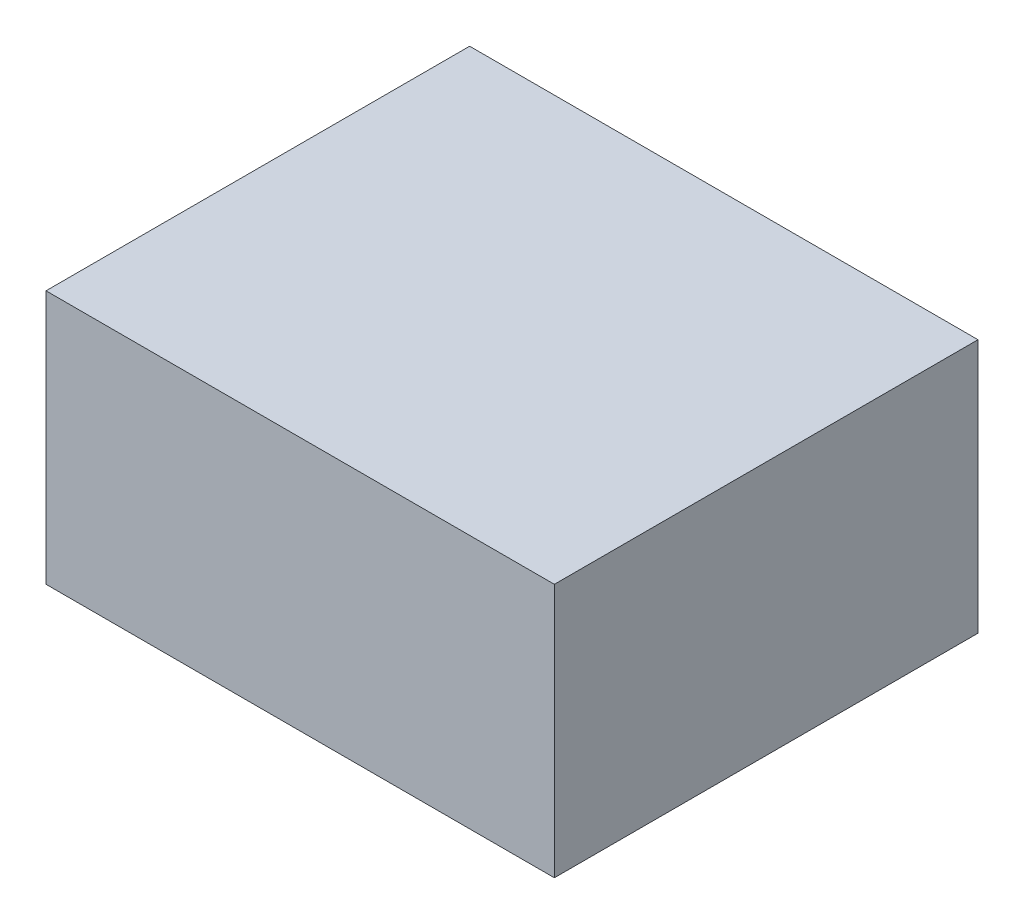
from build123d import *

# Parameters (mm, degrees)
SKETCH1_W           = 152.4
SKETCH1_H           = 127
BOSS_EXTRUDE1_DEPTH = 76.2


with BuildPart() as part:
    # Sketch1 → Boss-Extrude1 (new body)
    with BuildSketch(Plane(origin=(0, 0, 0), x_dir=(1, 0, 0), z_dir=(0, 1, 0))):
        Rectangle(SKETCH1_W, SKETCH1_H)
    extrude(amount=BOSS_EXTRUDE1_DEPTH)


solid = part.part
